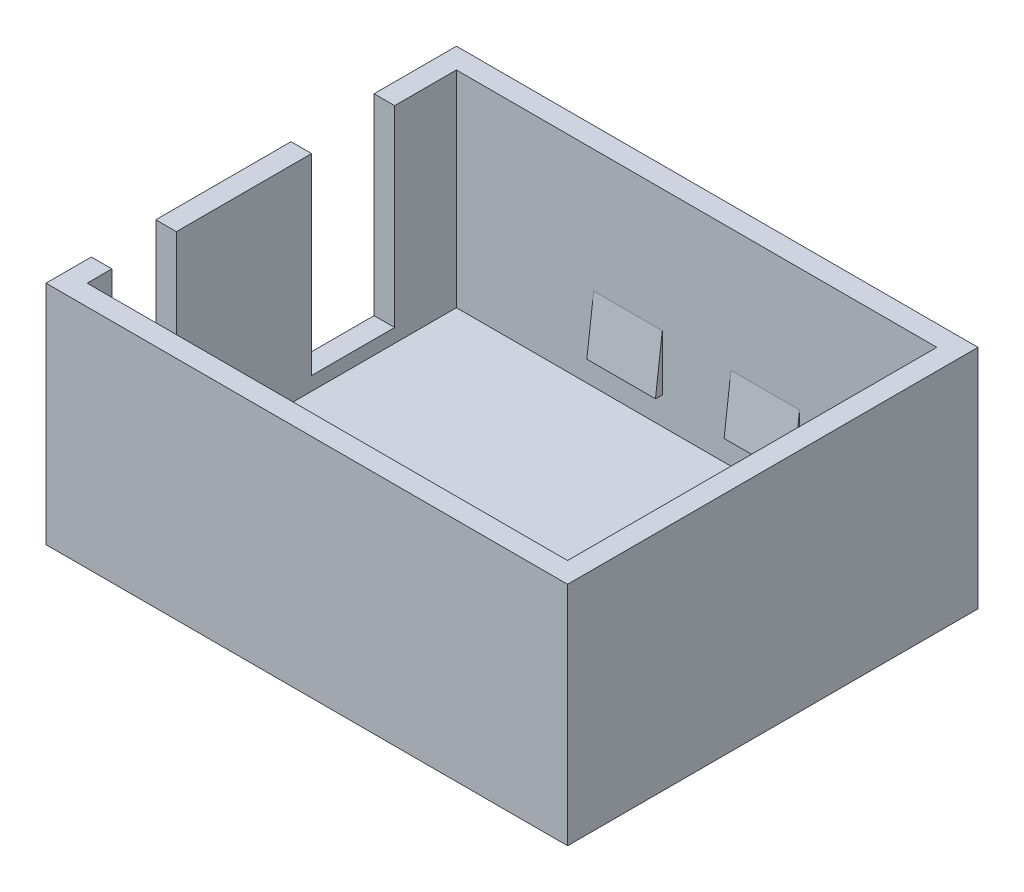
from build123d import *

# Parameters (mm, degrees)
CROQUIS1_W              = 76
CROQUIS1_H              = 59.8
CROQUIS1_W_2            = 70
CROQUIS1_H_2            = 53.8
SALIENTE_EXTRUIR1_DEPTH = 15
CROQUIS3_W              = 76
CROQUIS3_H              = 59.8
SALIENTE_EXTRUIR2_DEPTH = 3
CROQUIS4_W              = 6
CROQUIS4_H              = 12.1
CROQUIS4_H_2            = 9.4
CORTAR_EXTRUIR1_DEPTH   = 28
SALIENTE_EXTRUIR3_DEPTH = 5
SALIENTE_EXTRUIR4_DEPTH = 5
MATRIZL1_COUNT          = 2
MATRIZL1_PITCH          = 20
MATRIZL2_COUNT          = 2
MATRIZL2_PITCH          = 20
MATRIZL2_COL_COUNT      = 2
MATRIZL2_COL_PITCH      = 20


with BuildPart() as part:
    # Croquis1 → Saliente-Extruir1 (new, symmetric)
    with BuildSketch(Plane(origin=(0, 0, 0), x_dir=(1, 0, 0), z_dir=(0, 1, 0))):
        Rectangle(CROQUIS1_W, CROQUIS1_H)
        Rectangle(CROQUIS1_W_2, CROQUIS1_H_2, mode=Mode.SUBTRACT)
    extrude(amount=SALIENTE_EXTRUIR1_DEPTH, both=True)

    # Croquis3 → Saliente-Extruir2 (add)
    with BuildSketch(Plane.XZ.offset(15)):
        Rectangle(CROQUIS3_W, CROQUIS3_H)
    extrude(amount=SALIENTE_EXTRUIR2_DEPTH)

    # Croquis4 → Cortar-Extruir1 (cut)
    with BuildSketch(Plane(origin=(0, 15, 0), x_dir=(1, 0, 0), z_dir=(0, 1, 0))):
        with Locations((-38, 11.85)):
            Rectangle(CROQUIS4_W, CROQUIS4_H)
        with Locations((-38, -18.6)):
            Rectangle(CROQUIS4_W, CROQUIS4_H_2)
    extrude(amount=-CORTAR_EXTRUIR1_DEPTH, mode=Mode.SUBTRACT)

    # Croquis5 → Saliente-Extruir3 (add, symmetric)
    with BuildSketch(Plane(origin=(0, 0, 0), x_dir=(0, 0, -1), z_dir=(1, 0, 0))):
        Polygon((-26.9, -2.397546426), (-25.905143796, -10.5), (-26.9, -10.5), align=None)
    saliente_extruir3 = extrude(amount=SALIENTE_EXTRUIR3_DEPTH, both=True)

    # Croquis6 → Saliente-Extruir4 (add, symmetric)
    with BuildSketch(Plane(origin=(10, 0, -10), x_dir=(0, 0, 1), z_dir=(-1, 0, 0))):
        Polygon((-16.9, -2.897546426), (-15.905143796, -11), (-16.9, -11), align=None)
    saliente_extruir4 = extrude(amount=SALIENTE_EXTRUIR4_DEPTH, both=True)

    # MatrizL1: Saliente-Extruir4 ×2
    with Locations(*[(-i * MATRIZL1_PITCH, 0, 0) for i in range(1, MATRIZL1_COUNT)]):
        add(saliente_extruir4)

    # MatrizL2: Saliente-Extruir3 ×2
    with Locations(*[(i * MATRIZL2_PITCH, 0, 0) for i in range(1, MATRIZL2_COUNT)]):
        add(saliente_extruir3)

    # MatrizL2 col: Saliente-Extruir3 ×2
    with Locations(*[(-i * MATRIZL2_COL_PITCH, 0, 0) for i in range(1, MATRIZL2_COL_COUNT)]):
        add(saliente_extruir3)


solid = part.part
